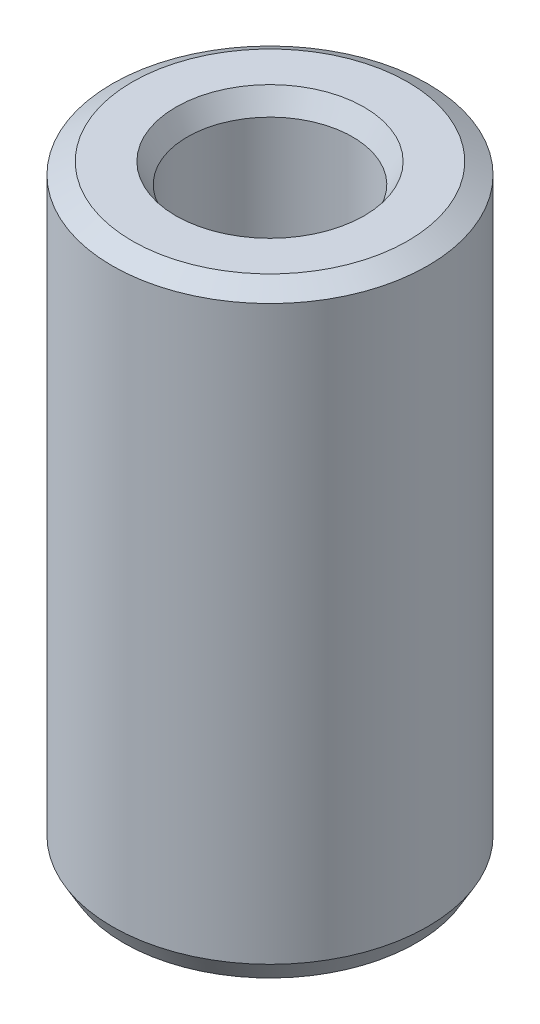
from build123d import *
from OCP.BRepFilletAPI import BRepFilletAPI_MakeChamfer

# Parameters (mm, degrees)
SKETCH1_R           = 37.5
BOSS_EXTRUDE1_DEPTH = 143.546503099
SKETCH2_R           = 19.638144701
CUT_EXTRUDE1_DEPTH  = 154.029730942
CHAMFER1_SIZE       = 2.74480157
CHAMFER1_SIZE2      = 4.754135776


with BuildPart() as part:
    # Sketch1 → Boss-Extrude1 (new body)
    with BuildSketch(Plane(origin=(0, 0, 0), x_dir=(1, 0, 0), z_dir=(0, 1, 0))):
        Circle(SKETCH1_R)
    extrude(amount=BOSS_EXTRUDE1_DEPTH)

    # Sketch2 → Cut-Extrude1 (cut, through all)
    with BuildSketch(Plane(origin=(0, 0, 0), x_dir=(1, 0, 0), z_dir=(0, 1, 0))):
        Circle(SKETCH2_R)
    extrude(amount=CUT_EXTRUDE1_DEPTH, mode=Mode.SUBTRACT)

    # Chamfer1: one chamfer whose edges measure the first distance from different faces: ONE call of the kernel's chamfer builder (chamfer() names one face for all edges)
    chamfer1_edges_1 = [part.edges().sort_by_distance(p)[0] for p in [
        (-19.638144701, 143.546503099, 0),
    ]]
    chamfer1_side_1 = [part.faces().sort_by_distance(p)[0] for p in [
        (-36.439339828, 143.546503099, 0),
    ]]
    chamfer1_edges_2 = [part.edges().sort_by_distance(p)[0] for p in [
        (-19.638144701, 0, 0),
    ]]
    chamfer1_side_2 = [part.faces().sort_by_distance(p)[0] for p in [
        (-19.638144701, 71.77325155, 0),
    ]]
    chamfer1_edges_3 = [part.edges().sort_by_distance(p)[0] for p in [
        (-37.5, 0, 0),
    ]]
    chamfer1_side_3 = [part.faces().sort_by_distance(p)[0] for p in [
        (-36.439339828, 0, 0),
    ]]
    chamfer1_edges_4 = [part.edges().sort_by_distance(p)[0] for p in [
        (-37.5, 143.546503099, 0),
    ]]
    chamfer1_side_4 = [part.faces().sort_by_distance(p)[0] for p in [
        (-37.5, 71.77325155, 0),
    ]]
    chamfer1 = BRepFilletAPI_MakeChamfer(part.part.solid().wrapped)
    for e in chamfer1_edges_1:
        chamfer1.Add(CHAMFER1_SIZE, CHAMFER1_SIZE2, e.wrapped, chamfer1_side_1[0].wrapped)  # the first distance lies on this face
    for e in chamfer1_edges_2:
        chamfer1.Add(CHAMFER1_SIZE, CHAMFER1_SIZE2, e.wrapped, chamfer1_side_2[0].wrapped)  # the first distance lies on this face
    for e in chamfer1_edges_3:
        chamfer1.Add(CHAMFER1_SIZE, CHAMFER1_SIZE2, e.wrapped, chamfer1_side_3[0].wrapped)  # the first distance lies on this face
    for e in chamfer1_edges_4:
        chamfer1.Add(CHAMFER1_SIZE, CHAMFER1_SIZE2, e.wrapped, chamfer1_side_4[0].wrapped)  # the first distance lies on this face
    add(Compound.cast(chamfer1.Shape()), mode=Mode.REPLACE)


solid = part.part
